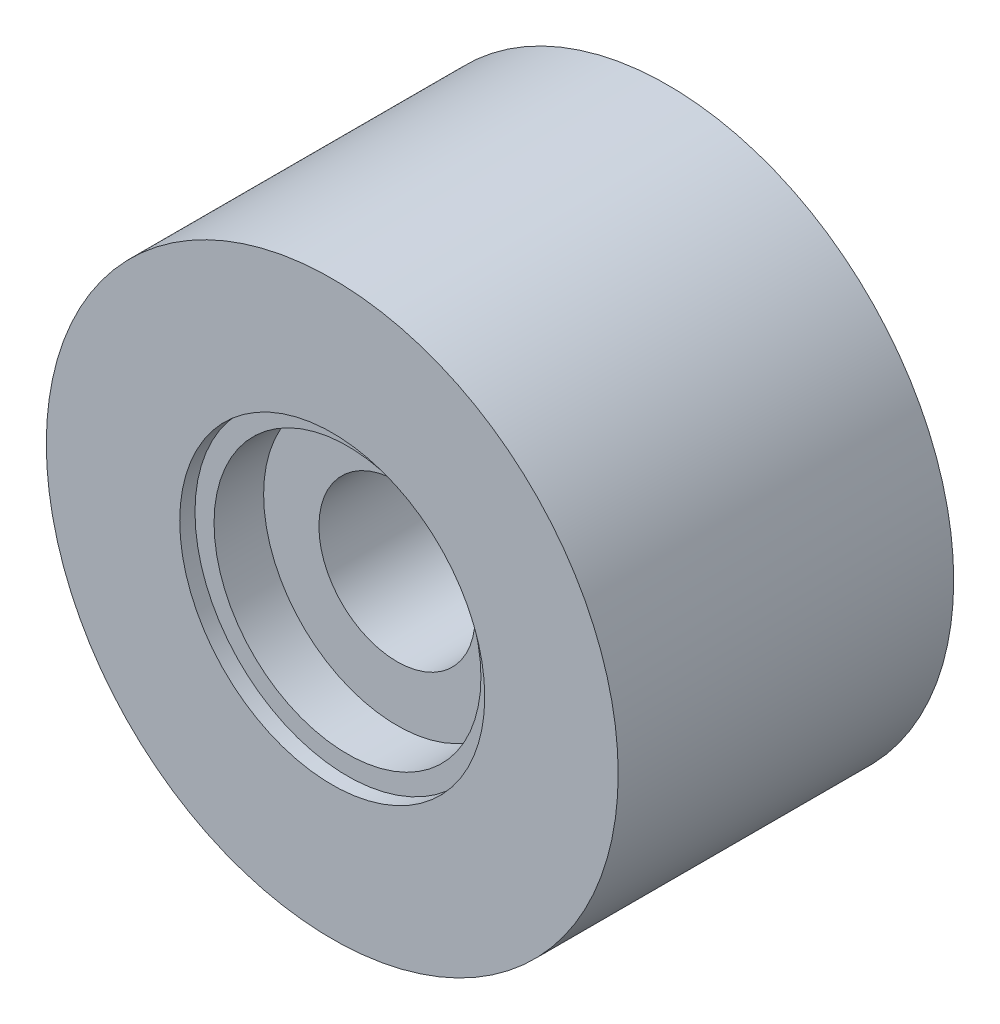
from build123d import *

# Parameters (mm, degrees)
SKETCH_1_R          = 15
SKETCH_1_R_2        = 7
EXTRUDE_1_DEPTH     = 2.6
SKETCH_2_R          = 15
SKETCH_2_R_2        = 4
EXTRUDE_2_DEPTH     = 10.8
SKETCH_3_R          = 15
SKETCH_3_R_2        = 7
EXTRUDE_3_DEPTH     = 2.6
EXTRUDE_START       = 0.8
SKETCH_4_R          = 15
SKETCH_4_R_2        = 8
EXTRUDE_4_DEPTH     = 0.8
SKETCH_5_R          = 15
SKETCH_5_R_2        = 8
EXTRUDE_5_DEPTH     = 0.8
SKETCH_6_R          = 4.1
CUT_EXTRUDE_1_DEPTH = 30


with BuildPart() as part:
    # 草图1 → 凸台-拉伸1 (new body)
    with BuildSketch(Plane.XY):
        Circle(SKETCH_1_R)
        Circle(SKETCH_1_R_2, mode=Mode.SUBTRACT)
    extrude(amount=EXTRUDE_1_DEPTH)

    # 草图2 → 凸台-拉伸2 (add)
    with BuildSketch(Plane.XY.offset(2.6)):
        Circle(SKETCH_2_R)
        Circle(SKETCH_2_R_2, mode=Mode.SUBTRACT)
    extrude(amount=EXTRUDE_2_DEPTH)

    # 草图3 → 凸台-拉伸3 (add)
    with BuildSketch(Plane.XY.offset(13.4)):
        Circle(SKETCH_3_R)
        Circle(SKETCH_3_R_2, mode=Mode.SUBTRACT)
    extrude(amount=EXTRUDE_3_DEPTH)

    # 草图4 → 凸台-拉伸4 (add)
    with BuildSketch(Plane(origin=(0, 0, 0), x_dir=(-1, 0, 0), z_dir=(0, 0, -1)).offset(EXTRUDE_START)):
        Circle(SKETCH_4_R)
        Circle(SKETCH_4_R_2, mode=Mode.SUBTRACT)
    extrude(amount=-EXTRUDE_4_DEPTH)

    # 草图5 → 凸台-拉伸5 (add)
    with BuildSketch(Plane.XY.offset(16)):
        Circle(SKETCH_5_R)
        Circle(SKETCH_5_R_2, mode=Mode.SUBTRACT)
    extrude(amount=EXTRUDE_5_DEPTH)

    # 草图6 → 切除-拉伸1 (cut)
    with BuildSketch(Plane(origin=(0, 0, 2.6), x_dir=(-1, 0, 0), z_dir=(0, 0, -1))):
        Circle(SKETCH_6_R)
    extrude(amount=-CUT_EXTRUDE_1_DEPTH, mode=Mode.SUBTRACT)


solid = part.part
